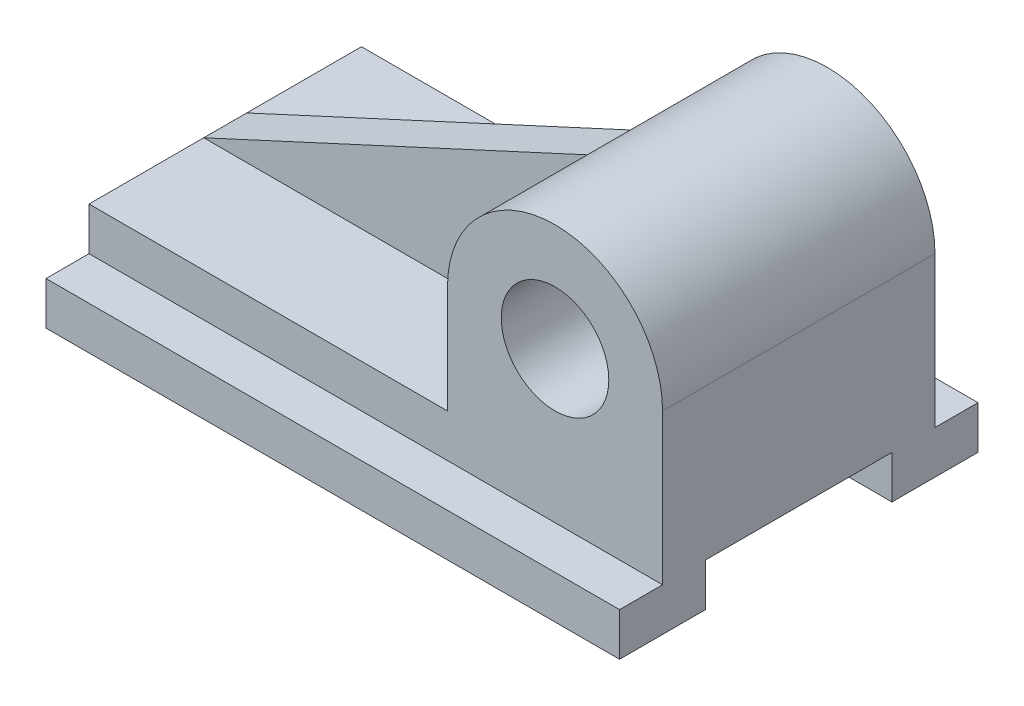
from build123d import *

# Parameters (mm, degrees)
SKETCH1_R           = 15
BOSS_EXTRUDE1_DEPTH = 76
SKETCH2_W           = 160
SKETCH2_H           = 24
BOSS_EXTRUDE2_DEPTH = 12
RIB1_START          = -6
RIB1_DEPTH          = 12


# Read off the part's stored shape, not the designer's step: Rib1
with BuildPart() as part:
    # Sketch1 → Boss-Extrude1 (new body)
    with BuildSketch(Plane.XY):
        with BuildLine():
            Line((-30, 0), (-30, -30))
            Line((-30, -30), (-130, -30))
            Line((-130, -30), (-130, -42))
            Line((-130, -42), (30, -42))
            Line((30, -42), (30, 0))
            ThreePointArc((30, 0), (0, 30), (-30, 0))
        make_face()
        Circle(SKETCH1_R, mode=Mode.SUBTRACT)
    extrude(amount=BOSS_EXTRUDE1_DEPTH)

    # Sketch2 → Boss-Extrude2 (add)
    with BuildSketch(Plane.XZ.offset(42)):
        with Locations((-50, 76)):
            Rectangle(SKETCH2_W, SKETCH2_H)
    boss_extrude2 = extrude(amount=BOSS_EXTRUDE2_DEPTH)

    # Mirror1: Boss-Extrude2 across plane
    add(boss_extrude2.mirror(Plane.XY.offset(38)))

    # Rib1 outline → Rib1 (add)
    with BuildSketch(Plane.XY.offset(38).offset(RIB1_START)):
        with BuildLine():
            Line((-22.829268293, 19.463414634), (-130, -30))
            Line((-130, -30), (-30, -30))
            Line((-30, -30), (-30, 0))
            ThreePointArc((-30, 0), (-28.150293505, 10.371160765), (-22.829268293, 19.463414634))
        make_face()
    extrude(amount=RIB1_DEPTH)


solid = part.part
